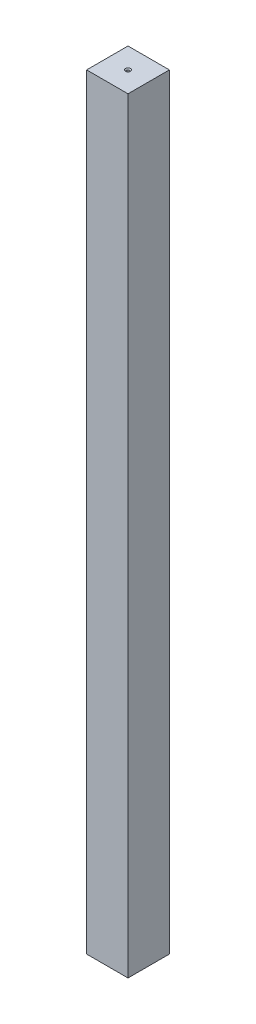
from build123d import *

# Parameters (mm, degrees)
SKETCH1_W           = 25.4
SKETCH1_H           = 25.4
BOSS_EXTRUDE1_DEPTH = 235


with BuildPart() as part:
    # Sketch1 → Boss-Extrude1 (new, symmetric)
    with BuildSketch(Plane(origin=(0, 0, 0), x_dir=(1, 0, 0), z_dir=(0, 1, 0))):
        Rectangle(SKETCH1_W, SKETCH1_H)
    extrude(amount=BOSS_EXTRUDE1_DEPTH, both=True)

    # Sketch3 → CSK for #0 Flat Head Machine Screw (100)1 (revolve, cut)
    with BuildSketch(Plane(origin=(0, 235, 0), x_dir=(0, 0, 1), z_dir=(1, 0, 0))):
        Polygon((0, 0), (0, 32.234564046), (0.80645, 31.75), (0.80645, 0.591439375), (1.5113, 0), align=None)
    csk_for_0_flat_head_machine_screw_100 = revolve(axis=Axis((0, 241.35, 0), (0, -1, 0)), mode=Mode.SUBTRACT)

    # Mirror1: CSK for #0 Flat Head Machine Screw (100)1 across plane
    add(csk_for_0_flat_head_machine_screw_100.mirror(Plane.ZX), mode=Mode.SUBTRACT)


solid = part.part
